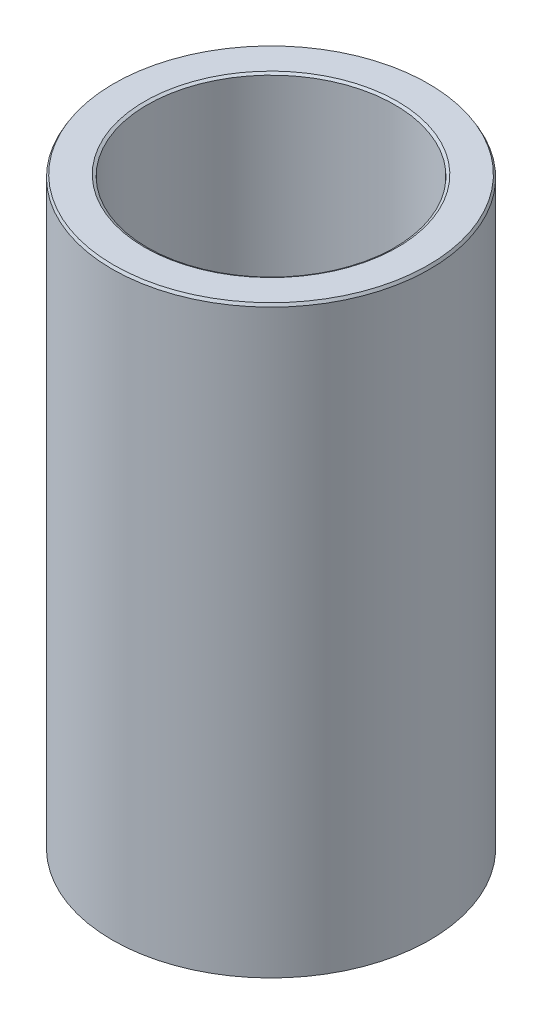
from build123d import *
from OCP.BRepFilletAPI import BRepFilletAPI_MakeChamfer

# Parameters (mm, degrees)
SKETCH1_R           = 50
BOSS_EXTRUDE1_DEPTH = 184.244225819
SKETCH2_R           = 38.943276588
CUT_EXTRUDE1_DEPTH  = 198.347244084
CHAMFER1_SIZE       = 0.858763281
CHAMFER1_SIZE2      = 0.495807211


with BuildPart() as part:
    # Sketch1 → Boss-Extrude1 (new body)
    with BuildSketch(Plane(origin=(0, 0, 0), x_dir=(1, 0, 0), z_dir=(0, 1, 0))):
        Circle(SKETCH1_R)
    extrude(amount=BOSS_EXTRUDE1_DEPTH)

    # Sketch2 → Cut-Extrude1 (cut, through all)
    with BuildSketch(Plane(origin=(0, 0, 0), x_dir=(1, 0, 0), z_dir=(0, 1, 0))):
        Circle(SKETCH2_R)
    extrude(amount=CUT_EXTRUDE1_DEPTH, mode=Mode.SUBTRACT)

    # Chamfer1: one chamfer whose edges measure the first distance from different faces: ONE call of the kernel's chamfer builder (chamfer() names one face for all edges)
    chamfer1_edges_1 = [part.edges().sort_by_distance(p)[0] for p in [
        (-38.943276588, 184.244225819, 0),
    ]]
    chamfer1_side_1 = [part.faces().sort_by_distance(p)[0] for p in [
        (-48.585786438, 184.244225819, 0),
    ]]
    chamfer1_edges_2 = [part.edges().sort_by_distance(p)[0] for p in [
        (-38.943276588, 0, 0),
    ]]
    chamfer1_side_2 = [part.faces().sort_by_distance(p)[0] for p in [
        (-38.943276588, 92.12211291, 0),
    ]]
    chamfer1_edges_3 = [part.edges().sort_by_distance(p)[0] for p in [
        (-50, 0, 0),
    ]]
    chamfer1_side_3 = [part.faces().sort_by_distance(p)[0] for p in [
        (-48.585786438, 0, 0),
    ]]
    chamfer1_edges_4 = [part.edges().sort_by_distance(p)[0] for p in [
        (-50, 184.244225819, 0),
    ]]
    chamfer1_side_4 = [part.faces().sort_by_distance(p)[0] for p in [
        (-50, 92.12211291, 0),
    ]]
    chamfer1 = BRepFilletAPI_MakeChamfer(part.part.solid().wrapped)
    for e in chamfer1_edges_1:
        chamfer1.Add(CHAMFER1_SIZE, CHAMFER1_SIZE2, e.wrapped, chamfer1_side_1[0].wrapped)  # the first distance lies on this face
    for e in chamfer1_edges_2:
        chamfer1.Add(CHAMFER1_SIZE, CHAMFER1_SIZE2, e.wrapped, chamfer1_side_2[0].wrapped)  # the first distance lies on this face
    for e in chamfer1_edges_3:
        chamfer1.Add(CHAMFER1_SIZE, CHAMFER1_SIZE2, e.wrapped, chamfer1_side_3[0].wrapped)  # the first distance lies on this face
    for e in chamfer1_edges_4:
        chamfer1.Add(CHAMFER1_SIZE, CHAMFER1_SIZE2, e.wrapped, chamfer1_side_4[0].wrapped)  # the first distance lies on this face
    add(Compound.cast(chamfer1.Shape()), mode=Mode.REPLACE)


solid = part.part
